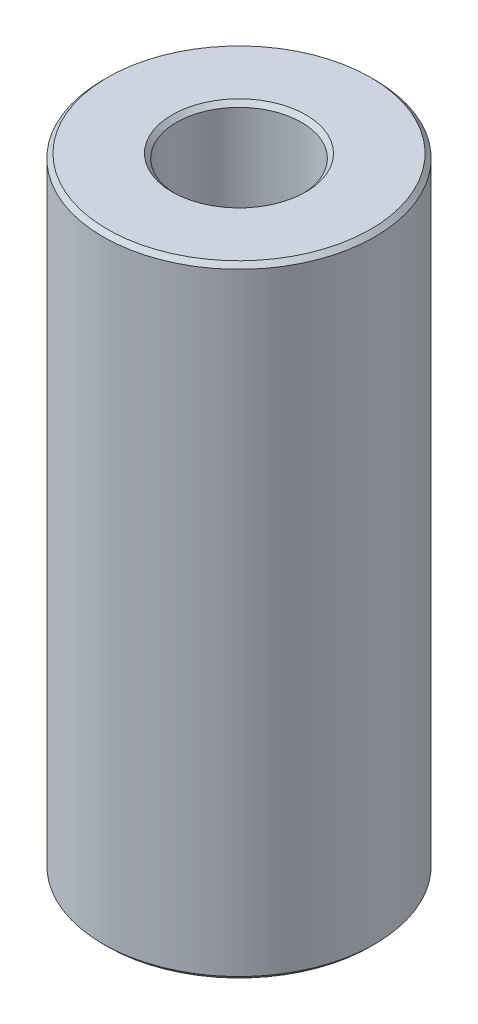
from build123d import *

# Parameters (mm, degrees)
SKETCH1_R           = 47.5
BOSS_EXTRUDE1_DEPTH = 217.077506229
SKETCH2_R           = 21.846034797
CUT_EXTRUDE1_DEPTH  = 228.233676445
CHAMFER1_SIZE       = 1.517793436


with BuildPart() as part:
    # Sketch1 → Boss-Extrude1 (new body)
    with BuildSketch(Plane(origin=(0, 0, 0), x_dir=(1, 0, 0), z_dir=(0, 1, 0))):
        Circle(SKETCH1_R)
    extrude(amount=BOSS_EXTRUDE1_DEPTH)

    # Sketch2 → Cut-Extrude1 (cut, through all)
    with BuildSketch(Plane(origin=(0, 0, 0), x_dir=(1, 0, 0), z_dir=(0, 1, 0))):
        Circle(SKETCH2_R)
    extrude(amount=CUT_EXTRUDE1_DEPTH, mode=Mode.SUBTRACT)

    # Chamfer1
    chamfer1_edges = [part.edges().sort_by_distance(p)[0] for p in [
        (-21.846034797, 217.077506229, 0),
        (-21.846034797, 0, 0),
        (-47.5, 0, 0),
        (-47.5, 217.077506229, 0),
    ]]
    chamfer(chamfer1_edges, length=CHAMFER1_SIZE)


solid = part.part
